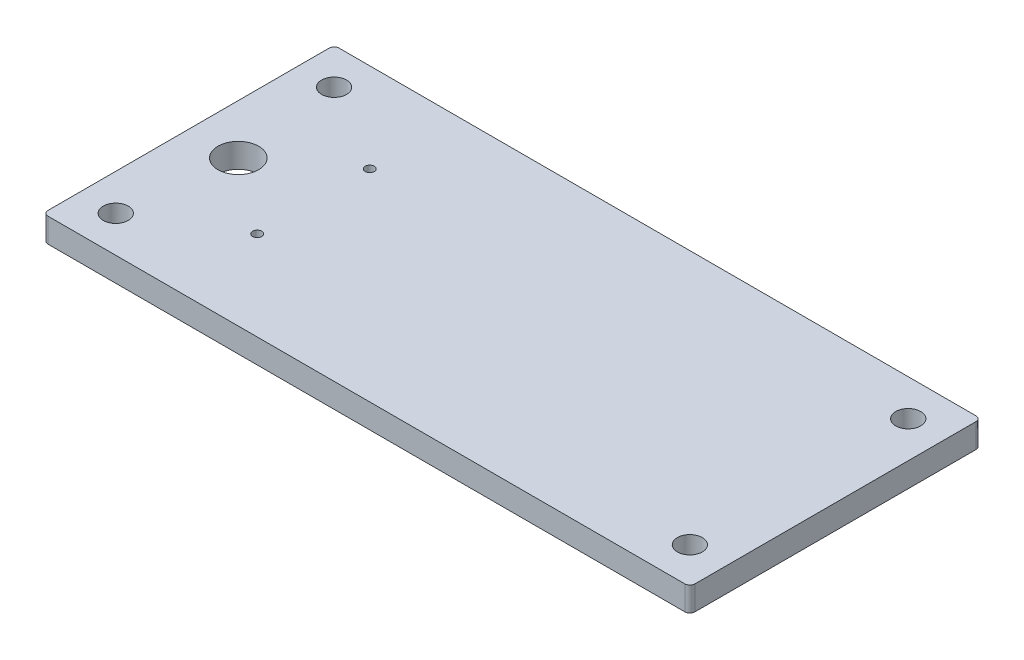
from build123d import *

# Parameters (mm, degrees)
SKETCH1_W                   = 254
SKETCH1_H                   = 114.3
BOSS_EXTRUDE1_DEPTH         = 9.525
FILLET1_R                   = 2
F_3_8_CLEARANCE_HOLE1_D     = 9.8044
F_3_8_CLEARANCE_HOLE1_DEPTH = 10
F_3_8_CLEARANCE_HOLE1_TIP   = 2.945538927
SKETCH10_R                  = 8
CUT_EXTRUDE2_DEPTH          = 140.5917194
M3_CLEARANCE_HOLE1_D        = 3.6
M3_CLEARANCE_HOLE1_DEPTH    = 10
M3_CLEARANCE_HOLE1_TIP      = 1.081549114


with BuildPart() as part:
    # Sketch1 → Boss-Extrude1 (new body)
    with BuildSketch(Plane(origin=(0, 0, 0), x_dir=(1, 0, 0), z_dir=(0, 1, 0))):
        Rectangle(SKETCH1_W, SKETCH1_H)
    extrude(amount=BOSS_EXTRUDE1_DEPTH)

    # Fillet1
    fillet1_edges = [part.edges().sort_by_distance(p)[0] for p in [
        (-127, 4.7625, -57.15),
        (127, 4.7625, -57.15),
        (-127, 4.7625, 57.15),
        (127, 4.7625, 57.15),
    ]]
    fillet(fillet1_edges, radius=FILLET1_R)

    # 3/8 Clearance Hole1
    with Locations(Plane(origin=(0, 9.525, 0), x_dir=(1, 0, 0), z_dir=(0, 1, 0))):
        with Locations((112.7125, 42.8625), (112.7125, -42.8675), (-112.7175, 42.8625), (-112.7175, -42.8675)):
            Hole(F_3_8_CLEARANCE_HOLE1_D / 2, depth=F_3_8_CLEARANCE_HOLE1_DEPTH)
            with Locations((0, 0, -(F_3_8_CLEARANCE_HOLE1_DEPTH + F_3_8_CLEARANCE_HOLE1_TIP / 2))):  # 118° drill point
                Cone(0, F_3_8_CLEARANCE_HOLE1_D / 2, F_3_8_CLEARANCE_HOLE1_TIP, mode=Mode.SUBTRACT)

    # Sketch10 → Cut-Extrude2 (cut, through all)
    with BuildSketch(Plane(origin=(0, 9.525, 0), x_dir=(1, 0, 0), z_dir=(0, 1, 0))):
        with Locations((-107.475, 0)):
            Circle(SKETCH10_R)
    extrude(amount=-CUT_EXTRUDE2_DEPTH, mode=Mode.SUBTRACT)

    # M3 Clearance Hole1
    with Locations(Plane(origin=(0, 9.525, 0), x_dir=(1, 0, 0), z_dir=(0, 1, 0))):
        with Locations((-77.95, 22.1), (-77.95, -22.1)):
            Hole(M3_CLEARANCE_HOLE1_D / 2, depth=M3_CLEARANCE_HOLE1_DEPTH)
            with Locations((0, 0, -(M3_CLEARANCE_HOLE1_DEPTH + M3_CLEARANCE_HOLE1_TIP / 2))):  # 118° drill point
                Cone(0, M3_CLEARANCE_HOLE1_D / 2, M3_CLEARANCE_HOLE1_TIP, mode=Mode.SUBTRACT)


solid = part.part
